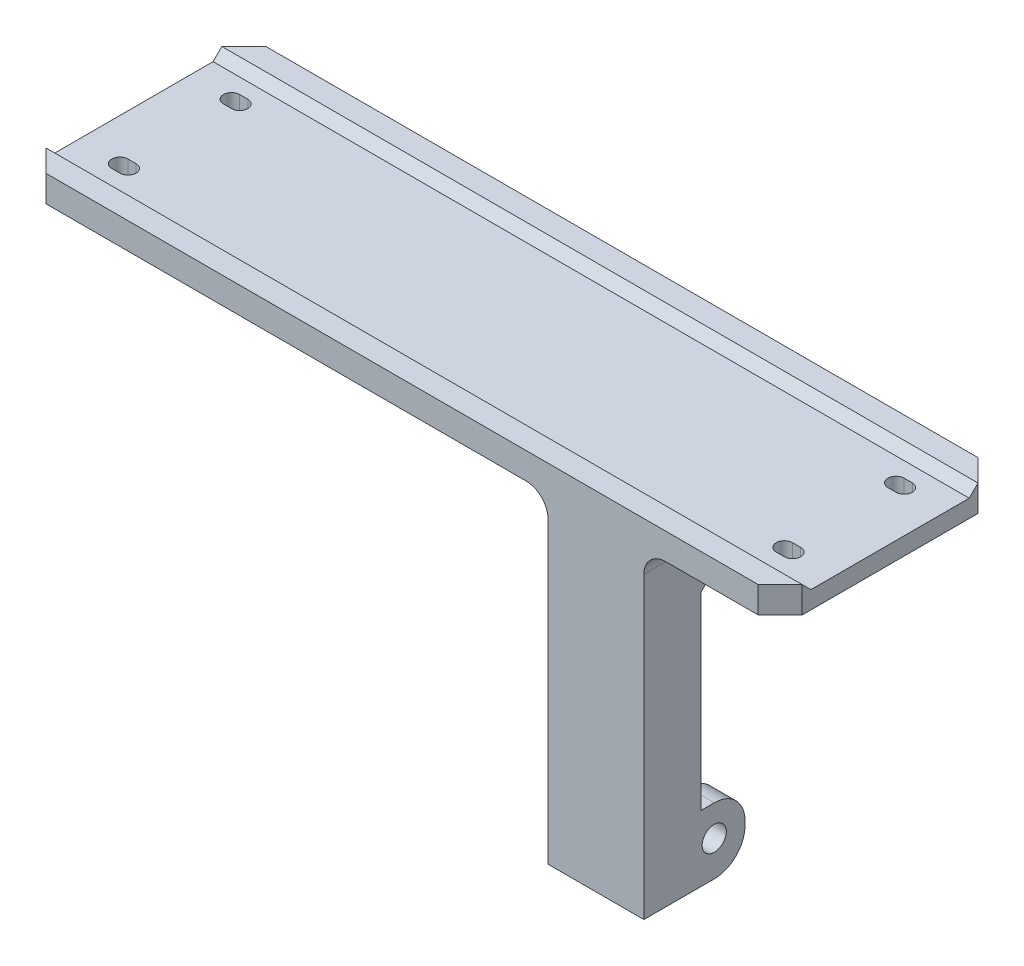
from build123d import *

# Parameters (mm, degrees)
SKETCH1_W           = 172
SKETCH1_H           = 4
BOSS_EXTRUDE1_DEPTH = 50
CUT_EXTRUDE1_DEPTH  = 50
SKETCH3_W           = 35
SKETCH3_H           = 73
BOSS_EXTRUDE2_DEPTH = 3
SKETCH4_W           = 2.8
SKETCH4_H           = 15
SKETCH4_W_2         = 6
BOSS_EXTRUDE3_DEPTH = 20
FILLET1_R           = 7
SKETCH5_R           = 2.75
CUT_EXTRUDE2_DEPTH  = 30
SKETCH6_W           = 5.6
SKETCH6_H           = 73
SKETCH6_W_2         = 7.6
CUT_EXTRUDE3_DEPTH  = 20
SKETCH7_W           = 6
SKETCH7_H           = 58
BOSS_EXTRUDE4_DEPTH = 10
CHAMFER1_SIZE       = 10
CHAMFER2_SIZE       = 15
FILLET2_R           = 5
SKETCH8_W           = 172
SKETCH8_H           = 4
BOSS_EXTRUDE5_DEPTH = 2
CHAMFER3_SIZE       = 3
CHAMFER4_SIZE       = 5


with BuildPart() as part:
    # Sketch1 → Boss-Extrude1 (new body)
    with BuildSketch(Plane.XY):
        Rectangle(SKETCH1_W, SKETCH1_H)
    extrude(amount=BOSS_EXTRUDE1_DEPTH)

    # Sketch2 → Cut-Extrude1 (cut)
    with BuildSketch(Plane(origin=(0, 2, 0), x_dir=(1, 0, 0), z_dir=(0, 1, 0))):
        with BuildLine():
            Line((-76.5, -10.45), (-74.65, -10.45))
            ThreePointArc((-74.65, -10.45), (-72.8, -12.3), (-74.65, -14.15))
            Line((-74.65, -14.15), (-76.5, -14.15))
            ThreePointArc((-76.5, -14.15), (-78.35, -12.3), (-76.5, -10.45))
        make_face()
        with BuildLine():
            Line((74.65, -10.45), (76.5, -10.45))
            ThreePointArc((76.5, -10.45), (78.35, -12.3), (76.5, -14.15))
            Line((76.5, -14.15), (74.65, -14.15))
            ThreePointArc((74.65, -14.15), (72.8, -12.3), (74.65, -10.45))
        make_face()
        with BuildLine():
            Line((-76.5, -35.85), (-74.65, -35.85))
            ThreePointArc((-74.65, -35.85), (-72.8, -37.7), (-74.65, -39.55))
            Line((-74.65, -39.55), (-76.5, -39.55))
            ThreePointArc((-76.5, -39.55), (-78.35, -37.7), (-76.5, -35.85))
        make_face()
        with BuildLine():
            Line((74.65, -35.85), (76.5, -35.85))
            ThreePointArc((76.5, -35.85), (78.35, -37.7), (76.5, -39.55))
            Line((76.5, -39.55), (74.65, -39.55))
            ThreePointArc((74.65, -39.55), (72.8, -37.7), (74.65, -35.85))
        make_face()
    extrude(amount=-CUT_EXTRUDE1_DEPTH, mode=Mode.SUBTRACT)

    # Sketch3 → Boss-Extrude2 (add)
    with BuildSketch(Plane.XY.offset(50)):
        with Locations((43.1, -38.5)):
            Rectangle(SKETCH3_W, SKETCH3_H)
    extrude(amount=-BOSS_EXTRUDE2_DEPTH)

    # Sketch4 → Boss-Extrude3 (add)
    with BuildSketch(Plane(origin=(0, 0, 47), x_dir=(-1, 0, 0), z_dir=(0, 0, -1))):
        with Locations((-44.1, -67.5)):
            Rectangle(SKETCH4_W, SKETCH4_H)
        with Locations((-36.2, -67.5)):
            Rectangle(SKETCH4_W_2, SKETCH4_H)
        with Locations((-52, -67.5)):
            Rectangle(SKETCH4_W_2, SKETCH4_H)
    extrude(amount=BOSS_EXTRUDE3_DEPTH)

    # Fillet1
    fillet1_edges = [part.edges().sort_by_distance(p)[0] for p in [
        (44.1, -75, 27),
        (44.1, -60, 27),
        (36.2, -75, 27),
        (36.2, -60, 27),
        (52, -60, 27),
        (52, -75, 27),
    ]]
    fillet(fillet1_edges, radius=FILLET1_R)

    # Sketch5 → Cut-Extrude2 (cut)
    with BuildSketch(Plane(origin=(55, 0, 0), x_dir=(0, 0, -1), z_dir=(1, 0, 0))):
        with Locations((-34, -67)):
            Circle(SKETCH5_R)
    extrude(amount=-CUT_EXTRUDE2_DEPTH, mode=Mode.SUBTRACT)

    # Sketch6 → Cut-Extrude3 (cut)
    with BuildSketch(Plane(origin=(0, 0, 47), x_dir=(-1, 0, 0), z_dir=(0, 0, -1))):
        with Locations((-57.8, -38.5)):
            Rectangle(SKETCH6_W, SKETCH6_H)
        with Locations((-29.4, -38.5)):
            Rectangle(SKETCH6_W_2, SKETCH6_H)
    extrude(amount=-CUT_EXTRUDE3_DEPTH, mode=Mode.SUBTRACT)

    # Sketch7 → Boss-Extrude4 (add)
    with BuildSketch(Plane(origin=(0, 0, 47), x_dir=(-1, 0, 0), z_dir=(0, 0, -1))):
        with Locations((-52, -31)):
            Rectangle(SKETCH7_W, SKETCH7_H)
        with Locations((-36.2, -31)):
            Rectangle(SKETCH7_W, SKETCH7_H)
    extrude(amount=BOSS_EXTRUDE4_DEPTH)

    # Chamfer1
    chamfer1_edges = [part.edges().sort_by_distance(p)[0] for p in [
        (44.1, -60, 47),
    ]]
    chamfer(chamfer1_edges, length=CHAMFER1_SIZE)

    # Chamfer2
    chamfer2_edges = [part.edges().sort_by_distance(p)[0] for p in [
        (52, -2, 37),
        (36.2, -2, 37),
    ]]
    chamfer(chamfer2_edges, length=CHAMFER2_SIZE)

    # Fillet2
    fillet2_edges = [part.edges().sort_by_distance(p)[0] for p in [
        (55, -2, 36),
        (33.2, -2, 36),
    ]]
    fillet(fillet2_edges, radius=FILLET2_R)

    # Sketch8 → Boss-Extrude5 (add)
    with BuildSketch(Plane(origin=(0, 2, 0), x_dir=(1, 0, 0), z_dir=(0, 1, 0))):
        with Locations((0, -2)):
            Rectangle(SKETCH8_W, SKETCH8_H)
        with Locations((0, -48)):
            Rectangle(SKETCH8_W, SKETCH8_H)
    extrude(amount=BOSS_EXTRUDE5_DEPTH)

    # Chamfer3
    # the kernel refuses this chamfer: 3 mm, written as the material it adds along each edge
    with BuildSketch(Plane(origin=(-86, 2, 46), x_dir=(0, -0.027495876610586334, -0.9996219169112968), z_dir=(1, 0, 0))) as chamfer3_piece_1_section:
        Polygon((CHAMFER3_SIZE * 0.999621916911, CHAMFER3_SIZE * 0.0274958766106), (-CHAMFER3_SIZE * 0.0274958766106, CHAMFER3_SIZE * 0.999621916911), (0, 0), align=None)
    chamfer3_piece_1 = extrude(amount=172, mode=Mode.PRIVATE)
    chamfer3_piece_1 = split(chamfer3_piece_1, bisect_by=Plane(origin=(0, 4, 44.907908995), z_dir=(0, -1, 0)), keep=Keep.TOP, mode=Mode.PRIVATE)
    add(chamfer3_piece_1)
    with BuildSketch(Plane(origin=(86, 2, 4), x_dir=(0, -0.02749587661058634, 0.9996219169112968), z_dir=(-1, 0, 0))) as chamfer3_piece_2_section:
        Polygon((CHAMFER3_SIZE * 0.999621916911, CHAMFER3_SIZE * 0.0274958766106), (-CHAMFER3_SIZE * 0.0274958766106, CHAMFER3_SIZE * 0.999621916911), (0, 0), align=None)
    chamfer3_piece_2 = extrude(amount=172, mode=Mode.PRIVATE)
    chamfer3_piece_2 = split(chamfer3_piece_2, bisect_by=Plane(origin=(0, 4, 5.092091005), z_dir=(0, -1, 0)), keep=Keep.TOP, mode=Mode.PRIVATE)
    add(chamfer3_piece_2)

    # Chamfer4
    chamfer4_edges = [part.edges().sort_by_distance(p)[0] for p in [
        (-86, 1, 0),
        (-86, 1, 50),
        (86, 1, 50),
        (86, 1, 0),
    ]]
    chamfer(chamfer4_edges, length=CHAMFER4_SIZE)


solid = part.part
